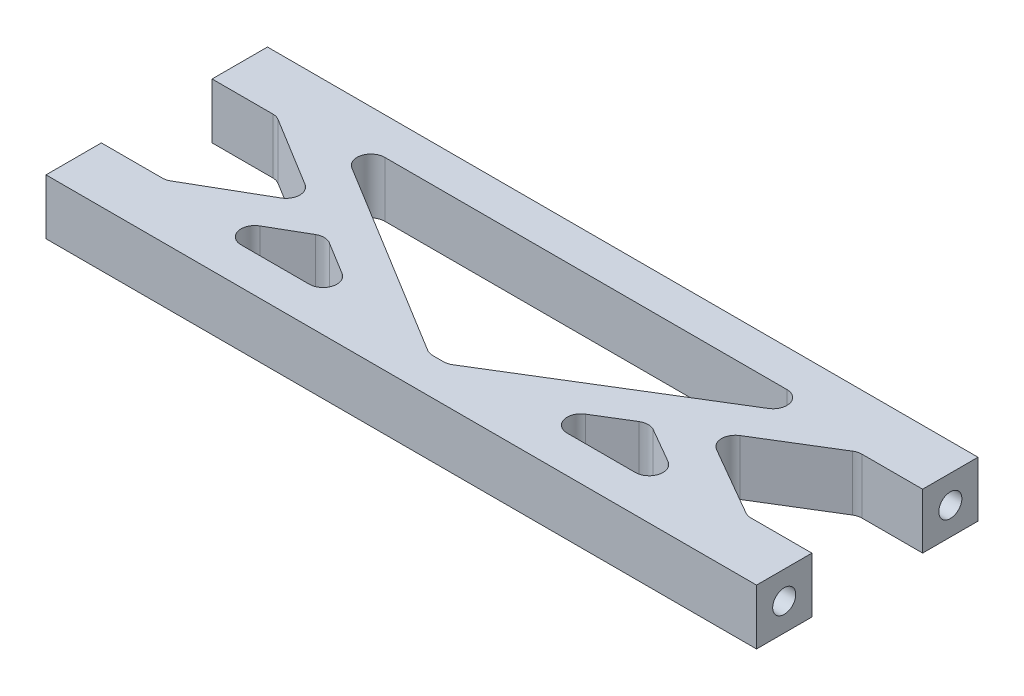
from build123d import *

# Parameters (mm, degrees)
SKETCH1_W                   = 77
SKETCH1_H                   = 24
BOSS_EXTRUDE1_DEPTH         = 6
CUT_EXTRUDE1_REACH          = 82.876
TAP_DRILL_FOR_M3_TAP1_D     = 2.5
TAP_DRILL_FOR_M3_TAP1_DEPTH = 10
TAP_DRILL_FOR_M3_TAP1_TIP   = 0.751075774
TAP_DRILL_FOR_M3_TAP2_D     = 2.5
TAP_DRILL_FOR_M3_TAP2_DEPTH = 10
TAP_DRILL_FOR_M3_TAP2_TIP   = 0.751075774
FILLET1_R                   = 1.5


with BuildPart() as part:
    # Sketch1 → Boss-Extrude1 (new body)
    with BuildSketch(Plane(origin=(0, 0, 0), x_dir=(1, 0, 0), z_dir=(0, 1, 0))):
        with Locations((38.5, 12)):
            Rectangle(SKETCH1_W, SKETCH1_H)
    extrude(amount=BOSS_EXTRUDE1_DEPTH)

    # Sketch2 → Cut-Extrude1 (cut, up to next)
    with BuildSketch(Plane(origin=(0, 6, 0), x_dir=(1, 0, 0), z_dir=(0, 1, 0)), mode=Mode.PRIVATE) as cut_extrude1_sk1:
        Polygon((0, 18), (7, 18), (17.082489299, 11.821127911), (7, 6), (0, 6), align=None)
    cut_extrude1_tool1 = extrude(cut_extrude1_sk1.sketch, amount=-CUT_EXTRUDE1_REACH, mode=Mode.PRIVATE) & part.part
    # Sketch2 → Cut-Extrude1 (cut, up to next)
    with BuildSketch(Plane(origin=(0, 6, 0), x_dir=(1, 0, 0), z_dir=(0, 1, 0)), mode=Mode.PRIVATE) as cut_extrude1_sk2:
        Polygon((11.391702814, 20), (65.608297186, 20), (39.5, 4), (37.5, 4), align=None)
    cut_extrude1_tool2 = extrude(cut_extrude1_sk2.sketch, amount=-CUT_EXTRUDE1_REACH, mode=Mode.PRIVATE) & part.part
    # Sketch2 → Cut-Extrude1 (cut, up to next)
    with BuildSketch(Plane(origin=(0, 6, 0), x_dir=(1, 0, 0), z_dir=(0, 1, 0)), mode=Mode.PRIVATE) as cut_extrude1_sk3:
        Polygon((77, 18), (70, 18), (59.917510701, 11.821127911), (70, 6), (77, 6), align=None)
    cut_extrude1_tool3 = extrude(cut_extrude1_sk3.sketch, amount=-CUT_EXTRUDE1_REACH, mode=Mode.PRIVATE) & part.part
    # Sketch2 → Cut-Extrude1 (cut, up to next)
    with BuildSketch(Plane(origin=(0, 6, 0), x_dir=(1, 0, 0), z_dir=(0, 1, 0)), mode=Mode.PRIVATE) as cut_extrude1_sk4:
        Polygon((20.963241239, 9.442878935), (11.535898385, 4), (29.844760038, 4), align=None)
    cut_extrude1_tool4 = extrude(cut_extrude1_sk4.sketch, amount=-CUT_EXTRUDE1_REACH, mode=Mode.PRIVATE) & part.part
    # Sketch2 → Cut-Extrude1 (cut, up to next)
    with BuildSketch(Plane(origin=(0, 6, 0), x_dir=(1, 0, 0), z_dir=(0, 1, 0)), mode=Mode.PRIVATE) as cut_extrude1_sk5:
        Polygon((47.155239962, 4), (56.036758761, 9.442878935), (65.464101615, 4), align=None)
    cut_extrude1_tool5 = extrude(cut_extrude1_sk5.sketch, amount=-CUT_EXTRUDE1_REACH, mode=Mode.PRIVATE) & part.part
    add(cut_extrude1_tool1.solids().sort_by_distance((6.372388, 6, -11.975038))[0], mode=Mode.SUBTRACT)
    add(cut_extrude1_tool2.solids().sort_by_distance((38.5, 6, -14.476924))[0], mode=Mode.SUBTRACT)
    add(cut_extrude1_tool3.solids().sort_by_distance((70.627612, 6, -11.975038))[0], mode=Mode.SUBTRACT)
    add(cut_extrude1_tool4.solids().sort_by_distance((20.7813, 6, -5.814293))[0], mode=Mode.SUBTRACT)
    add(cut_extrude1_tool5.solids().sort_by_distance((56.2187, 6, -5.814293))[0], mode=Mode.SUBTRACT)

    # Tap Drill for M3 Tap1
    with Locations(Plane.ZY):
        with Locations((-21, 3), (-3, 3)):
            Hole(TAP_DRILL_FOR_M3_TAP1_D / 2, depth=TAP_DRILL_FOR_M3_TAP1_DEPTH)
            with Locations((0, 0, -(TAP_DRILL_FOR_M3_TAP1_DEPTH + TAP_DRILL_FOR_M3_TAP1_TIP / 2))):  # 118° drill point
                Cone(0, TAP_DRILL_FOR_M3_TAP1_D / 2, TAP_DRILL_FOR_M3_TAP1_TIP, mode=Mode.SUBTRACT)

    # Tap Drill for M3 Tap2
    with Locations(Plane(origin=(77, 0, 0), x_dir=(0, 0, -1), z_dir=(1, 0, 0))):
        with Locations((3, 3), (21, 3)):
            Hole(TAP_DRILL_FOR_M3_TAP2_D / 2, depth=TAP_DRILL_FOR_M3_TAP2_DEPTH)
            with Locations((0, 0, -(TAP_DRILL_FOR_M3_TAP2_DEPTH + TAP_DRILL_FOR_M3_TAP2_TIP / 2))):  # 118° drill point
                Cone(0, TAP_DRILL_FOR_M3_TAP2_D / 2, TAP_DRILL_FOR_M3_TAP2_TIP, mode=Mode.SUBTRACT)

    # Fillet1
    fillet1_edges = [part.edges().sort_by_distance(p)[0] for p in [
        (47.155239962, 3, -4),
        (56.036758761, 3, -9.442878935),
        (70, 3, -6),
        (59.917510701, 3, -11.821127911),
        (70, 3, -18),
        (65.608297186, 3, -20),
        (39.5, 3, -4),
        (37.5, 3, -4),
        (11.391702814, 3, -20),
        (29.844760038, 3, -4),
        (20.963241239, 3, -9.442878935),
        (7, 3, -6),
        (17.082489299, 3, -11.821127911),
        (7, 3, -18),
        (65.464101615, 3, -4),
        (11.535898385, 3, -4),
    ]]
    fillet(fillet1_edges, radius=FILLET1_R)


solid = part.part
